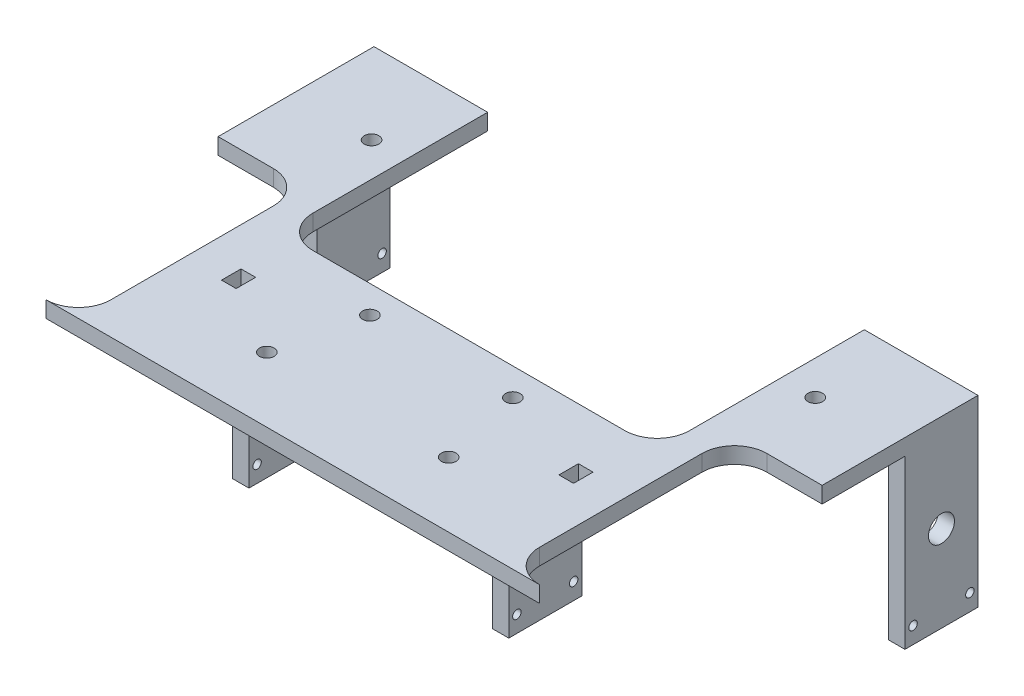
from build123d import *

# Parameters (mm, degrees)
BOSS_EXTRUDE1_DEPTH      = 5
SKETCH2_W                = 5
SKETCH2_H                = 22.5
BOSS_EXTRUDE2_DEPTH      = 38
SKETCH5_W                = 25
SKETCH5_H                = 5
BOSS_EXTRUDE3_DEPTH      = 30
FILLET3_R                = 5
SKETCH6_R                = 3
CUT_EXTRUDE4_DEPTH       = 172
SKETCH7_W                = 5
SKETCH7_H                = 22.5
BOSS_EXTRUDE4_DEPTH      = 51.5
SKETCH3_R                = 1.3
CUT_EXTRUDE2_DEPTH       = 357.71872673
SKETCH9_W                = 116
SKETCH9_H                = 63.779574991
CUT_EXTRUDE6_DEPTH       = 10
SKETCH10_W               = 25
SKETCH10_H               = 5
BOSS_EXTRUDE5_DEPTH      = 70
BOSS_EXTRUDE6_DEPTH      = 25
SKETCH12_W               = 25
SKETCH12_H               = 5
BOSS_EXTRUDE7_DEPTH      = 19.72
BOSS_EXTRUDE8_DEPTH      = 15
BOSS_EXTRUDE8_DEPTH_BACK = 4
CUT_EXTRUDE7_DEPTH       = 15
SKETCH15_R               = 2.25
CUT_EXTRUDE8_DEPTH       = 20
SKETCH16_W               = 6
SKETCH16_H               = 3
BOSS_EXTRUDE9_DEPTH      = 12.4
SKETCH17_R               = 1
CUT_EXTRUDE9_DEPTH       = 282.347152812
SKETCH27_W               = 25.232191294
SKETCH27_H               = 19
BOSS_EXTRUDE11_DEPTH     = 3
FILLET4_R                = 5
SKETCH18_R               = 2.25
CUT_EXTRUDE10_DEPTH      = 378.078044336
SKETCH19_W               = 4.5
SKETCH19_H               = 6
CUT_EXTRUDE12_DEPTH      = 383.13686347
FILLET6_R                = 10
SKETCH21_W               = 27
SKETCH21_H               = 70
CUT_EXTRUDE14_DEPTH      = 383.13686347
FILLET7_R                = 10
SKETCH22_R               = 2.25
CUT_EXTRUDE16_DEPTH      = 10
SKETCH23_W               = 17.043474802
SKETCH23_H               = 5.138762975
BOSS_EXTRUDE10_DEPTH     = 7
CUT_EXTRUDE17_REACH      = 372.436
CUT_EXTRUDE18_REACH      = 380.086
SKETCH25_R               = 2.25
SKETCH28_R               = 2.25
CUT_EXTRUDE19_DEPTH      = 384.936136276
SKETCH30_W               = 438.94108036
SKETCH30_H               = 213.926961157
CUT_EXTRUDE22_DEPTH      = 384.936136276
SKETCH31_W               = 83.134099451
SKETCH31_H               = 28.659633058
CUT_EXTRUDE23_DEPTH      = 253.735705209
SKETCH32_R               = 2.25
CUT_EXTRUDE24_DEPTH      = 227.212842253
CUT_EXTRUDE26_DEPTH      = 110
CUT_EXTRUDE26_DEPTH_BACK = 10
SKETCH33_R               = 4
SKETCH34_R               = 4
CUT_EXTRUDE27_DEPTH      = 227.212842253


with BuildPart() as part:
    # Sketch1 → Boss-Extrude1 (new body)
    with BuildSketch(Plane(origin=(0, 0, 0), x_dir=(1, 0, 0), z_dir=(0, 1, 0))):
        Polygon((0, 0), (0, -300), (186, -300), (186, 0), (176, 0), (151, 0), (151, -56.115865257), (35, -56.115865257), (35, 0), (10, 0), align=None)
    extrude(amount=BOSS_EXTRUDE1_DEPTH)

    # Sketch2 → Boss-Extrude2 (add)
    with BuildSketch(Plane.XZ):
        with Locations((53, 82.75)):
            Rectangle(SKETCH2_W, SKETCH2_H)
        with Locations((133, 82.75)):
            Rectangle(SKETCH2_W, SKETCH2_H)
    extrude(amount=BOSS_EXTRUDE2_DEPTH)

    # Sketch5 → Boss-Extrude3 (add)
    with BuildSketch(Plane.XZ):
        with Locations((173.5, 297.5)):
            Rectangle(SKETCH5_W, SKETCH5_H)
        with Locations((173.5, 242.5)):
            Rectangle(SKETCH5_W, SKETCH5_H)
        with Locations((173.5, 187.5)):
            Rectangle(SKETCH5_W, SKETCH5_H)
        with Locations((173.5, 132.5)):
            Rectangle(SKETCH5_W, SKETCH5_H)
    extrude(amount=BOSS_EXTRUDE3_DEPTH)

    # Fillet3
    fillet3_edges = [part.edges().sort_by_distance(p)[0] for p in [
        (173.5, 0, 130),
        (173.5, 0, 185),
        (173.5, 0, 240),
        (173.5, 0, 295),
    ]]
    fillet(fillet3_edges, radius=FILLET3_R)

    # Sketch6 → Cut-Extrude4 (cut)
    with BuildSketch(Plane.XY.offset(300)):
        with Locations((178, -24)):
            Circle(SKETCH6_R)
    extrude(amount=-CUT_EXTRUDE4_DEPTH, mode=Mode.SUBTRACT)

    # Sketch7 → Boss-Extrude4 (add)
    with BuildSketch(Plane.XZ):
        with Locations((2.5, 11.25)):
            Rectangle(SKETCH7_W, SKETCH7_H)
        with Locations((183.5, 11.25)):
            Rectangle(SKETCH7_W, SKETCH7_H)
    extrude(amount=BOSS_EXTRUDE4_DEPTH)

    # Sketch3 → Cut-Extrude2 (cut, through all)
    with BuildSketch(Plane(origin=(186, 0, 0), x_dir=(0, 0, -1), z_dir=(1, 0, 0))):
        with Locations((-74, -32.9)):
            Circle(SKETCH3_R)
        with Locations((-91.5, -32.9)):
            Circle(SKETCH3_R)
        with Locations((-20, -46.4)):
            Circle(SKETCH3_R)
        with Locations((-2.5, -46.4)):
            Circle(SKETCH3_R)
    extrude(amount=-CUT_EXTRUDE2_DEPTH, mode=Mode.SUBTRACT)

    # Sketch9 → Cut-Extrude6 (cut)
    with BuildSketch(Plane.XZ):
        with Locations((93, 31.889787496)):
            Rectangle(SKETCH9_W, SKETCH9_H)
    extrude(amount=-CUT_EXTRUDE6_DEPTH, mode=Mode.SUBTRACT)

    # Sketch10 → Boss-Extrude5 (add)
    with BuildSketch(Plane.XZ.offset(30)):
        with Locations((173.5, 297.5)):
            Rectangle(SKETCH10_W, SKETCH10_H)
        with Locations((173.5, 132.5)):
            Rectangle(SKETCH10_W, SKETCH10_H)
    extrude(amount=BOSS_EXTRUDE5_DEPTH)

    # Sketch11 → Boss-Extrude6 (add)
    with BuildSketch(Plane(origin=(186, 0, 0), x_dir=(0, 0, -1), z_dir=(1, 0, 0))):
        Polygon((-300, -100), (-304.901863346, -134.643852153), (-300, -135.337431613), (-295, -100), align=None)
    extrude(amount=-BOSS_EXTRUDE6_DEPTH)

    # Sketch12 → Boss-Extrude7 (add)
    with BuildSketch(Plane.XZ.offset(100)):
        with Locations((173.5, 132.5)):
            Rectangle(SKETCH12_W, SKETCH12_H)
    extrude(amount=BOSS_EXTRUDE7_DEPTH)

    # Sketch13 → Boss-Extrude8 (add, two sides: drawn at the far end of the back side and taken through both)
    with BuildSketch(Plane(origin=(0, 0, 130), x_dir=(-1, 0, 0), z_dir=(0, 0, -1)).offset(-BOSS_EXTRUDE8_DEPTH_BACK)):
        Polygon((-186, -115.314128401), (-186, -119.72), (-161, -123.135183378), (-161, -115.314128401), align=None)
    extrude(amount=BOSS_EXTRUDE8_DEPTH + BOSS_EXTRUDE8_DEPTH_BACK)

    # Sketch14 → Cut-Extrude7 (cut)
    with BuildSketch(Plane(origin=(19.462480736, -142.470246704, 0), x_dir=(0.9907978149243062, 0.13535024913615948, 0), z_dir=(0.13535024913615948, -0.9907978149243062, 0))):
        Polygon((186.357631366, 115), (168.084261749, 132.037436989), (198.015187573, 130.430954629), (197.515117956, 111.366582762), (186.357631366, 109.607523038), align=None)
    extrude(amount=-CUT_EXTRUDE7_DEPTH, mode=Mode.SUBTRACT)

    # Sketch15 → Cut-Extrude8 (cut)
    with BuildSketch(Plane(origin=(0, 39.65203451, 280.240211564), x_dir=(1, 0, 0), z_dir=(0, 0.14009757598944012, 0.9901377021414158))):
        with Locations((178, -168.031966348)):
            Circle(SKETCH15_R)
        with Locations((169, -149.043043011)):
            Circle(SKETCH15_R)
    extrude(amount=-CUT_EXTRUDE8_DEPTH, mode=Mode.SUBTRACT)

    # Sketch16 → Boss-Extrude9 (add)
    with BuildSketch(Plane.XZ):
        with Locations((169, 273.5)):
            Rectangle(SKETCH16_W, SKETCH16_H)
        with Locations((140.4, 273.5)):
            Rectangle(SKETCH16_W, SKETCH16_H)
        with Locations((169, 218.5)):
            Rectangle(SKETCH16_W, SKETCH16_H)
        with Locations((169, 163.5)):
            Rectangle(SKETCH16_W, SKETCH16_H)
        with Locations((140.4, 218.5)):
            Rectangle(SKETCH16_W, SKETCH16_H)
        with Locations((140.4, 163.5)):
            Rectangle(SKETCH16_W, SKETCH16_H)
    extrude(amount=BOSS_EXTRUDE9_DEPTH)

    # Sketch17 → Cut-Extrude9 (cut, through all)
    with BuildSketch(Plane(origin=(0, 0, 162), x_dir=(-1, 0, 0), z_dir=(0, 0, -1))):
        with Locations((-168.95, -6.2)):
            Circle(SKETCH17_R)
        with Locations((-140.45, -6.2)):
            Circle(SKETCH17_R)
    extrude(amount=-CUT_EXTRUDE9_DEPTH, mode=Mode.SUBTRACT)

    # Sketch27 → Boss-Extrude11 (add)
    with BuildSketch(Plane(origin=(19.462480736, -142.470246704, 0), x_dir=(0.9907978149243062, 0.13535024913615953, 0), z_dir=(0.13535024913615953, -0.9907978149243062, 0))):
        with Locations((155.468166102, 124.5)):
            Rectangle(SKETCH27_W, SKETCH27_H)
    extrude(amount=BOSS_EXTRUDE11_DEPTH)

    # Fillet4
    fillet4_edges = [part.edges().sort_by_distance(p)[0] for p in [
        (140.4, 0, 275),
        (169, 0, 275),
        (140.4, 0, 220),
        (169, 0, 220),
        (140.4, 0, 165),
        (169, 0, 165),
    ]]
    fillet(fillet4_edges, radius=FILLET4_R)

    # Sketch18 → Cut-Extrude10 (cut, through all)
    with BuildSketch(Plane(origin=(0, -115.314128401, 0), x_dir=(1, 0, 0), z_dir=(0, 1, 0))):
        with Locations((174.885718372, -120.99470656)):
            Circle(SKETCH18_R)
    extrude(amount=-CUT_EXTRUDE10_DEPTH, mode=Mode.SUBTRACT)

    # Sketch19 → Cut-Extrude12 (cut, through all)
    with BuildSketch(Plane.XZ):
        with Locations((41.05, 82.75)):
            Rectangle(SKETCH19_W, SKETCH19_H)
        with Locations((144.95, 82.75)):
            Rectangle(SKETCH19_W, SKETCH19_H)
    extrude(amount=-CUT_EXTRUDE12_DEPTH, mode=Mode.SUBTRACT)

    # Fillet6
    fillet6_edges = [part.edges().sort_by_distance(p)[0] for p in [
        (151, 2.5, 63.779574991),
        (35, 2.5, 63.779574991),
    ]]
    fillet(fillet6_edges, radius=FILLET6_R)

    # Sketch21 → Cut-Extrude14 (cut, through all)
    with BuildSketch(Plane.XZ):
        with Locations((13.5, 83)):
            Rectangle(SKETCH21_W, SKETCH21_H)
        with Locations((172.5, 83)):
            Rectangle(SKETCH21_W, SKETCH21_H)
    extrude(amount=-CUT_EXTRUDE14_DEPTH, mode=Mode.SUBTRACT)

    # Fillet7
    fillet7_edges = [part.edges().sort_by_distance(p)[0] for p in [
        (27, 2.5, 118),
        (27, 2.5, 48),
        (159, 2.5, 48),
        (159, 2.5, 118),
    ]]
    fillet(fillet7_edges, radius=FILLET7_R)

    # Sketch22 → Cut-Extrude16 (cut)
    with BuildSketch(Plane.XZ):
        with Locations((24.5, 25.25)):
            Circle(SKETCH22_R)
        with Locations((161.5, 25.617459027)):
            Circle(SKETCH22_R)
        with Locations((115, 72.25)):
            Circle(SKETCH22_R)
        with Locations((71, 72.25)):
            Circle(SKETCH22_R)
    extrude(amount=-CUT_EXTRUDE16_DEPTH, mode=Mode.SUBTRACT)

    # Sketch23 → Boss-Extrude10 (add)
    with BuildSketch(Plane.XY.offset(135)):
        with Locations((169.584553608, -121.006176699)):
            Rectangle(SKETCH23_W, SKETCH23_H)
    extrude(amount=BOSS_EXTRUDE10_DEPTH)

    # Sketch24 → Cut-Extrude17 (cut, up to next)
    with BuildSketch(Plane.ZY.offset(-161.062816207), mode=Mode.PRIVATE) as cut_extrude17_sk1:
        Polygon((142, -121.648432415), (135, -122.638883571), (134.714975443, -124.33810847), (142, -124.33810847), align=None)
    cut_extrude17_tool1 = extrude(cut_extrude17_sk1.sketch, amount=-CUT_EXTRUDE17_REACH, mode=Mode.PRIVATE) & part.part
    add(cut_extrude17_tool1.solids().sort_by_distance((161.062816, -123.230784, 138.703404))[0], mode=Mode.SUBTRACT)

    # Sketch25 → Cut-Extrude18 (cut, up to next)
    with BuildSketch(Plane(origin=(0, -118.436795211, 0), x_dir=(1, 0, 0), z_dir=(0, 1, 0)), mode=Mode.PRIVATE) as cut_extrude18_sk1:
        with Locations((174.719138996, -138.089405518)):
            Circle(SKETCH25_R)
    cut_extrude18_tool1 = extrude(cut_extrude18_sk1.sketch, amount=-CUT_EXTRUDE18_REACH, mode=Mode.PRIVATE) & part.part
    add(cut_extrude18_tool1.solids().sort_by_distance((174.719139, -118.436795, 138.089406))[0], mode=Mode.SUBTRACT)

    # Sketch28 → Cut-Extrude19 (cut, through all)
    with BuildSketch(Plane(origin=(0, 5, 0), x_dir=(1, 0, 0), z_dir=(0, 1, 0))):
        with Locations((93, -260)):
            Circle(SKETCH28_R)
    extrude(amount=-CUT_EXTRUDE19_DEPTH, mode=Mode.SUBTRACT)

    # Sketch30 → Cut-Extrude22 (cut, through all)
    with BuildSketch(Plane(origin=(0, 5, 0), x_dir=(1, 0, 0), z_dir=(0, 1, 0))):
        with Locations((159.951638518, -224.963480578)):
            Rectangle(SKETCH30_W, SKETCH30_H)
    extrude(amount=-CUT_EXTRUDE22_DEPTH, mode=Mode.SUBTRACT)


with BuildPart() as cut_extrude22_piece_1:
    # of the separate pieces the step leaves, piece 1, a body of its own (cut_extrude22_pieces)
    add(part.part.solids().sort_by_distance((169, 0, 48))[0])

    # Sketch32 → Cut-Extrude24 (cut, through all)
    with BuildSketch(Plane.XZ):
        with Locations((121, 98)):
            Circle(SKETCH32_R)
        with Locations((65, 98)):
            Circle(SKETCH32_R)
    extrude(amount=-CUT_EXTRUDE24_DEPTH, mode=Mode.SUBTRACT)

    # Sketch33 → Cut-Extrude26 (cut, two sides: drawn at the far end of the back side and taken through both)
    with BuildSketch(Plane(origin=(55.5, 0, 0), x_dir=(0, 0, -1), z_dir=(1, 0, 0)).offset(-CUT_EXTRUDE26_DEPTH_BACK)):
        with Locations((-82.75, -11.4)):
            Circle(SKETCH33_R)
    extrude(amount=CUT_EXTRUDE26_DEPTH + CUT_EXTRUDE26_DEPTH_BACK, mode=Mode.SUBTRACT)

    # Sketch34 → Cut-Extrude27 (cut, through all)
    with BuildSketch(Plane(origin=(186, 0, 0), x_dir=(0, 0, -1), z_dir=(1, 0, 0))):
        with Locations((-11.25, -24.9)):
            Circle(SKETCH34_R)
    extrude(amount=-CUT_EXTRUDE27_DEPTH, mode=Mode.SUBTRACT)


with BuildPart() as cut_extrude22_piece_2:
    # of the separate pieces the step leaves, piece 2, a body of its own (cut_extrude22_pieces)
    add(part.part.solids().sort_by_distance((186, -115.314128401, 118))[0])

    # Sketch31 → Cut-Extrude23 (cut, through all)
    with BuildSketch(Plane(origin=(0, 0, 115), x_dir=(-1, 0, 0), z_dir=(0, 0, -1))):
        with Locations((-171.317335901, -127.032941637)):
            Rectangle(SKETCH31_W, SKETCH31_H)
    extrude(amount=-CUT_EXTRUDE23_DEPTH, mode=Mode.SUBTRACT)


solid = cut_extrude22_piece_1.part
